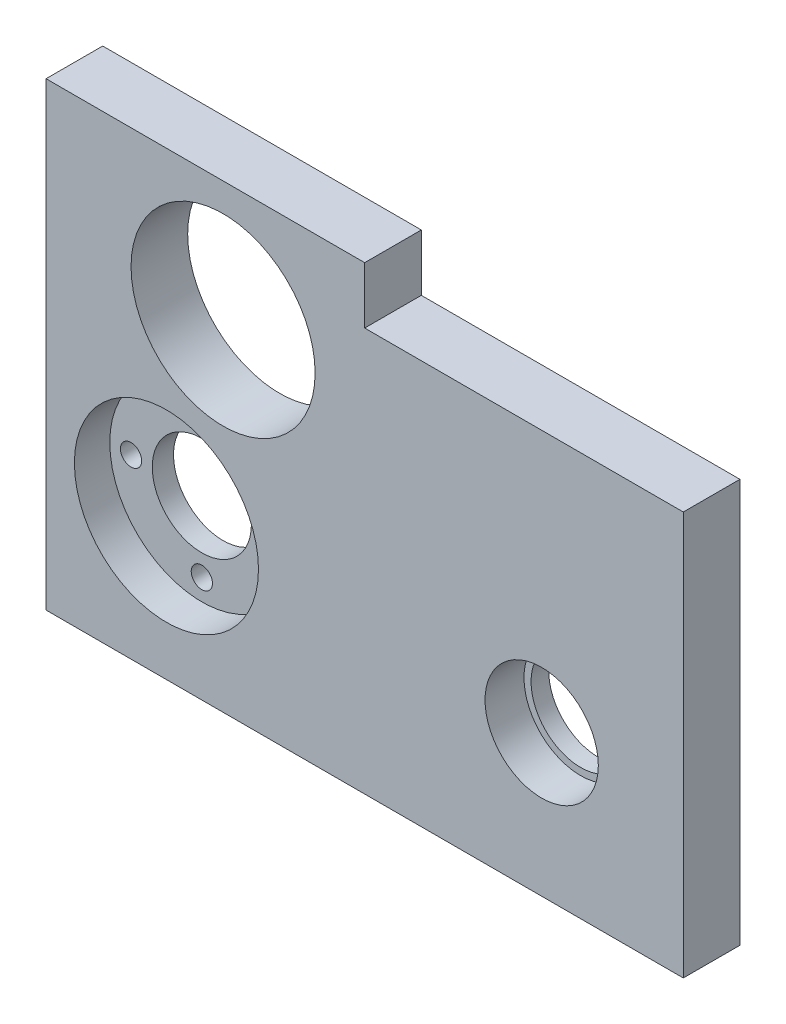
from build123d import *

# Parameters (mm, degrees)
ESQUISSE1_W             = 90
ESQUISSE1_H             = 65
ESQUISSE1_R             = 7
ESQUISSE1_R_2           = 13
BOSS_EXTRU_1_DEPTH      = 8
ESQUISSE2_R             = 13
BOSS_EXTRU_2_DEPTH      = 3
ESQUISSE3_R             = 7
ESQUISSE3_R_2           = 1.5
ENL_V_MAT_EXTRU_1_DEPTH = 112.130553854
ESQUISSE4_R             = 8
ENL_V_MAT_EXTRU_2_DEPTH = 5.5
ESQUISSE5_W             = 45
ESQUISSE5_H             = 8
ENL_V_MAT_EXTRU_3_DEPTH = 112.30588484


with BuildPart() as part:
    # Esquisse1 → Boss.-Extru.1 (new body)
    with BuildSketch(Plane.XY):
        with Locations((45, 32.5)):
            Rectangle(ESQUISSE1_W, ESQUISSE1_H)
        with Locations((70, 20)):
            Circle(ESQUISSE1_R, mode=Mode.SUBTRACT)
        with Locations((17, 20)):
            Circle(ESQUISSE1_R_2, mode=Mode.SUBTRACT)
        with Locations((25, 48)):
            Circle(ESQUISSE1_R_2, mode=Mode.SUBTRACT)
    extrude(amount=BOSS_EXTRU_1_DEPTH)

    # Esquisse2 → Boss.-Extru.2 (add)
    with BuildSketch(Plane(origin=(0, 0, 0), x_dir=(-1, 0, 0), z_dir=(0, 0, -1))):
        with Locations((-17, 20)):
            Circle(ESQUISSE2_R)
    extrude(amount=-BOSS_EXTRU_2_DEPTH)

    # Esquisse3 → Enlèv. mat.-Extru.1 (cut, through all)
    with BuildSketch(Plane.XY.offset(3)):
        with Locations((17, 20)):
            Circle(ESQUISSE3_R)
        with Locations((27, 20)):
            Circle(ESQUISSE3_R_2)
        with Locations((17, 10)):
            Circle(ESQUISSE3_R_2)
        with Locations((7, 20)):
            Circle(ESQUISSE3_R_2)
        with Locations((17, 30)):
            Circle(ESQUISSE3_R_2)
    extrude(amount=-ENL_V_MAT_EXTRU_1_DEPTH, mode=Mode.SUBTRACT)

    # Esquisse4 → Enlèv. mat.-Extru.2 (cut)
    with BuildSketch(Plane.XY.offset(8)):
        with Locations((70, 20)):
            Circle(ESQUISSE4_R)
    extrude(amount=-ENL_V_MAT_EXTRU_2_DEPTH, mode=Mode.SUBTRACT)

    # Esquisse5 → Enlèv. mat.-Extru.3 (cut, through all)
    with BuildSketch(Plane.XY.offset(8)):
        with Locations((67.5, 61)):
            Rectangle(ESQUISSE5_W, ESQUISSE5_H)
    extrude(amount=-ENL_V_MAT_EXTRU_3_DEPTH, mode=Mode.SUBTRACT)


solid = part.part
